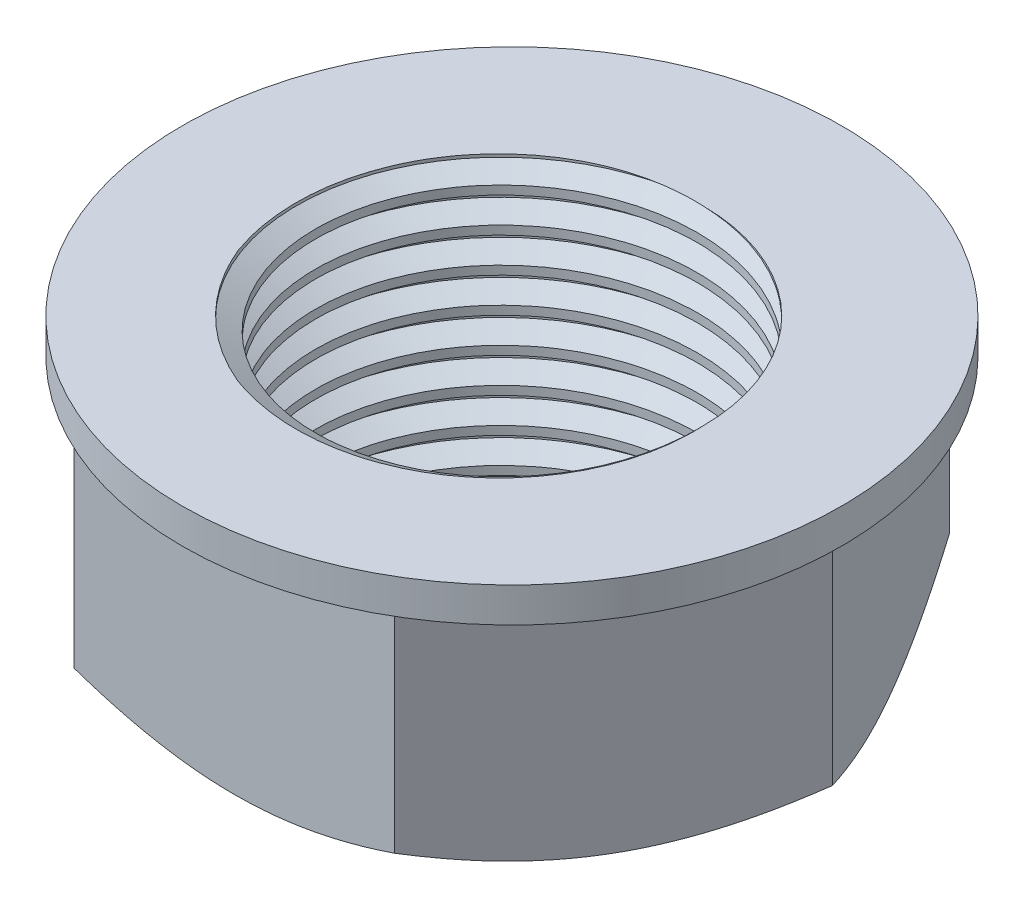
from build123d import *

# Parameters (mm, degrees)
SKETCH6_R           = 11
BOSS_EXTRUDE3_DEPTH = 16
BOSS_EXTRUDE4_START = 2
SKETCH8_R           = 19
SKETCH8_R_2         = 11
BOSS_EXTRUDE4_DEPTH = 2
THREAD2_PITCH       = 2


with BuildPart() as part:
    # Sketch6 → Boss-Extrude3 (new body)
    with BuildSketch(Plane(origin=(0, 0, 0), x_dir=(1, 0, 0), z_dir=(0, 1, 0))):
        Polygon((18.475208614, 0), (9.237604307, 16), (-9.237604307, 16), (-18.475208614, 0), (-9.237604307, -16), (9.237604307, -16), align=None)
        with Locations(Location((0, 0, 0), (0, 0, 270))):
            Circle(SKETCH6_R, mode=Mode.SUBTRACT)
    extrude(amount=-BOSS_EXTRUDE3_DEPTH)

    # Sketch7 → Cut-Revolve3 (revolve, cut)
    with BuildSketch(Plane.XY, mode=Mode.PRIVATE) as cut_revolve3_sk:
        Polygon((-19.712739194, -11.367236869), (-11.466793241, -16.986324816), (-19.712739194, -16.986324816), align=None)
    revolve(cut_revolve3_sk.sketch.rotate(Axis((0, -8.107713708, 0), (0, -1, 0)), 270), axis=Axis((0, -8.107713708, 0), (0, -1, 0)), mode=Mode.SUBTRACT)

    # Sketch8 → Boss-Extrude4 (add)
    with BuildSketch(Plane(origin=(0, 0, 0), x_dir=(1, 0, 0), z_dir=(0, 1, 0)).offset(BOSS_EXTRUDE4_START)):
        with Locations(Location((0, 0, 0), (0, 0, 270))):
            Circle(SKETCH8_R)
        with Locations(Location((0, 0, 0), (0, 0, 270))):
            Circle(SKETCH8_R_2, mode=Mode.SUBTRACT)
    extrude(amount=-BOSS_EXTRUDE4_DEPTH)

    # Thread2: the profile of Thread Profile2 profile screwed along a right-hand helix of 9 turns, 10 arcs to a turn; built about Z, then put on its axis
    thread2_z = Axis((0, 0, 0), (0, 0, 1))
    thread2_corners = [(10.9997, 0, -0.000173205), (12.08253175, 0, 0.624999997), (12.08253175, 0, 0.874999997), (10.9997, 0, 1.5001732)]
    with BuildLine(mode=Mode.PRIVATE) as thread2_profile:
        Line(thread2_corners[0], thread2_corners[1])
        Line(thread2_corners[1], thread2_corners[2])
        Line(thread2_corners[2], thread2_corners[3])
        Line(thread2_corners[3], thread2_corners[0])
    thread2_cap = Face(thread2_profile.wire())
    thread2_turn_angles = [0, 18, 36, 54, 72, 90, 108, 126, 144, 162, 180, 198, 216, 234, 252, 270, 288, 306, 324, 342, 360]
    thread2_turn_weights = [1, 0.9510565162951535, 1, 0.9510565162951535, 1, 0.9510565162951535, 1, 0.9510565162951535, 1, 0.9510565162951535, 1, 0.9510565162951535, 1, 0.9510565162951535, 1, 0.9510565162951535, 1, 0.9510565162951535, 1, 0.9510565162951535, 1]
    thread2_turn_rails = [Edge.make_bspline([Vector(p[0], p[1], 0).rotate(thread2_z, thread2_turn_angles[k]) / thread2_turn_weights[k] + Vector(0, 0, p[2] + THREAD2_PITCH * thread2_turn_angles[k] / 360) for k in range(21)], [0, 0, 0, 1, 1, 2, 2, 3, 3, 4, 4, 5, 5, 6, 6, 7, 7, 8, 8, 9, 9, 10, 10, 10], 2, thread2_turn_weights) for p in thread2_corners]
    thread2_turn_sides = [Face.make_surface_from_curves(thread2_turn_rails[p[0]], thread2_turn_rails[p[1]]) for p in [(0, 1), (1, 2), (2, 3), (3, 0)]]
    thread2 = Plane(origin=(0, -16, 0), x_dir=(1, 0, 0), z_dir=(0, 1, 0)) * Solid(Shell([*[p.moved(Location((0, 0, THREAD2_PITCH * i))) for i in range(9) for p in thread2_turn_sides], thread2_cap, thread2_cap.rotate(thread2_z, 3240).moved(Location((0, 0, THREAD2_PITCH * 3240 / 360)))]))
    add(thread2, mode=Mode.SUBTRACT)


solid = part.part
